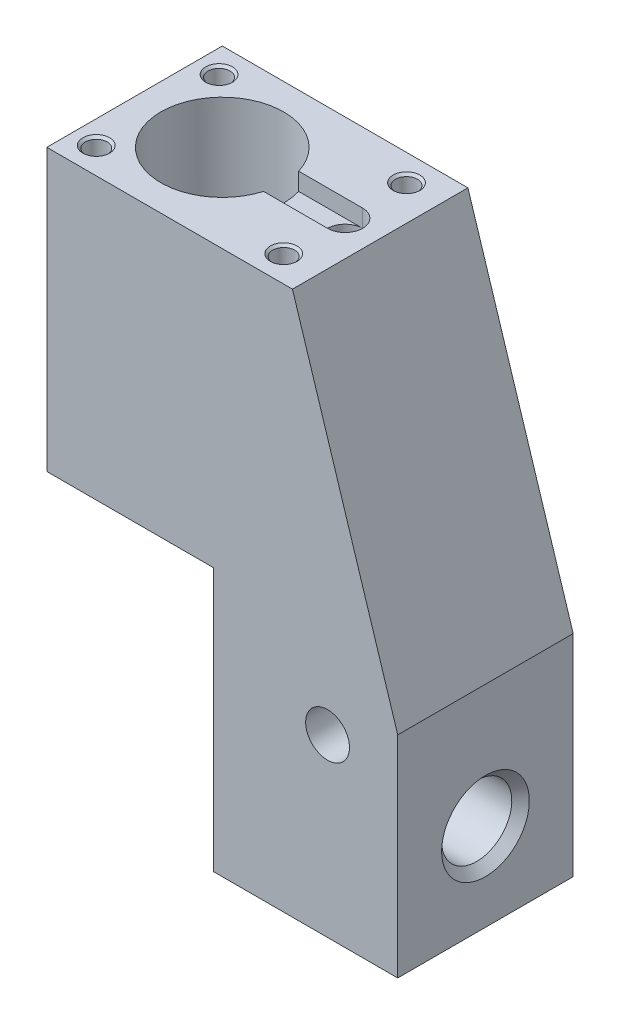
from build123d import *

# Parameters (mm, degrees)
BOSS_EXTRUDE1_DEPTH         = 10
CUT_EXTRUDE1_DEPTH          = 67.21933252457322
CUT_EXTRUDE2_DEPTH          = 2
M3_TAPPED_HOLE1_D           = 2.5
M3_TAPPED_HOLE1_DEPTH       = 9
M3_TAPPED_HOLE1_CSINK_D     = 3.05
M3_TAPPED_HOLE1_CSINK_ANGLE = 90
M3_TAPPED_HOLE1_TIP         = 0.7510757737844503
SKETCH5_R                   = 2.4999999999999987
CUT_EXTRUDE3_DEPTH          = 44.18564576337837
SKETCH6_R                   = 4
CUT_EXTRUDE4_DEPTH          = 53.191953402799555
CHAMFER1_SIZE               = 1
HOLE1_START                 = 2
HOLE1_OUTLINE_R             = 2
HOLE1_DEPTH                 = 28
HOLE1_START_2               = -16.200329062
HOLE1_2_OUTLINE_R           = 1.25
HOLE1_2_DEPTH               = 18.200329062
CUT_EXTRUDE5_REACH          = 54.192
CUT_EXTRUDE5_END_RADIUS     = 7
SKETCH9_R                   = 1.6000000000000005
M4_TAPPED_HOLE1_REACH       = 68.219
M4_TAPPED_HOLE1_BORE_R      = 1.65
CUT_EXTRUDE6_REACH          = 68.219
CUT_EXTRUDE6_END_RADIUS     = 2.4999999999999987
SKETCH12_R                  = 1.2499999999999991


# Read off the part's stored shape, not the designer's step: Hole1
with BuildPart() as part:
    # Sketch1 → Boss-Extrude1 (new, symmetric)
    with BuildSketch(Plane.XY):
        Polygon((0, 0), (-19.000000000000004, -3.04e-15), (-19, 32), (8.999999999999991, 32), (21, -5.9999999999999964), (21, -29.999999999999996), (3.47e-15, -30), align=None)
    extrude(amount=BOSS_EXTRUDE1_DEPTH, both=True)

    # Sketch2 → Cut-Extrude1 (cut, through all)
    with BuildSketch(Plane(origin=(0, 32, 0), x_dir=(1, 0, 0), z_dir=(0, 1, 0))):
        with BuildLine():
            ThreePointArc((-2.2917960675006315, 2.000000000000001), (-10.010587075047079, 6.926666858146693), (-16, -2.25e-15))
            Line((-16, 0), (-2, 0))
            ThreePointArc((-2, 0), (-2.0733331418533067, 1.0105870750470785), (-2.2917960675006315, 2.000000000000001))
        make_face()
        with BuildLine():
            Line((-2, 0), (-16, 0))
            ThreePointArc((-16, 8.6e-16), (-10.01058707504708, -6.926666858146693), (-2.2917960675006324, -2.0000000000000036))
            ThreePointArc((-2.2917960675006324, -2.0000000000000036), (-2.0733331418533067, -1.0105870750470807), (-2, -1.71e-15))
        make_face()
    extrude(amount=-CUT_EXTRUDE1_DEPTH, mode=Mode.SUBTRACT)

    # Sketch2<3> → Cut-Extrude2 (cut)
    with BuildSketch(Plane(origin=(0, 32, 0), x_dir=(1, 0, 0), z_dir=(0, 1, 0))):
        with BuildLine():
            ThreePointArc((5.000000000000001, 2.0000000000000004), (3.585786437626906, 1.4142135623730954), (3.0000000000000004, 2.4e-16))
            Line((3, 0), (7, 0))
            ThreePointArc((7.000000000000002, 0), (6.414213562373096, 1.4142135623730951), (5.000000000000001, 2.0000000000000004))
        make_face()
        with BuildLine():
            Line((7, 0), (3, 0))
            ThreePointArc((3.0000000000000004, 2.4e-16), (3.585786437626905, -1.4142135623730951), (5.000000000000001, -2.0000000000000004))
            ThreePointArc((5.000000000000001, -2.0000000000000004), (6.414213562373096, -1.4142135623730956), (7.000000000000002, -4.9e-16))
        make_face()
        with BuildLine():
            Line((3, 0), (-2, 0))
            ThreePointArc((-2, -1.71e-15), (-2.0733331418533067, -1.0105870750470807), (-2.2917960675006324, -2.0000000000000036))
            Line((-2.2917960675006315, -2.0000000000000013), (5.000000000000001, -2.0000000000000004))
            ThreePointArc((5.000000000000001, -2.0000000000000004), (3.585786437626905, -1.4142135623730951), (3.0000000000000004, 2.4e-16))
        make_face()
        with BuildLine():
            ThreePointArc((-2.2917960675006315, 2.000000000000001), (-2.0733331418533067, 1.0105870750470785), (-2, 0))
            Line((-2, 0), (3, 0))
            ThreePointArc((3.0000000000000004, 2.4e-16), (3.585786437626906, 1.4142135623730954), (5.000000000000001, 2.0000000000000004))
            Line((5.000000000000001, 2.0000000000000004), (-2.2917960675006315, 2.0000000000000013))
        make_face()
    extrude(amount=-CUT_EXTRUDE2_DEPTH, mode=Mode.SUBTRACT)

    # M3 Tapped Hole1
    with Locations(Plane(origin=(0, 32, 0), x_dir=(1, 0, 0), z_dir=(0, 1, 0))):
        with Locations((-16.363887926, 7), (-16.363887926, -7), (5, -7), (5, 7)):
            CounterSinkHole(M3_TAPPED_HOLE1_D / 2, M3_TAPPED_HOLE1_CSINK_D / 2, depth=M3_TAPPED_HOLE1_DEPTH, counter_sink_angle=M3_TAPPED_HOLE1_CSINK_ANGLE)
            with Locations((0, 0, -(M3_TAPPED_HOLE1_DEPTH + M3_TAPPED_HOLE1_TIP / 2))):  # 118° drill point
                Cone(0, M3_TAPPED_HOLE1_D / 2, M3_TAPPED_HOLE1_TIP, mode=Mode.SUBTRACT)

    # Sketch5 → Cut-Extrude3 (cut, through all)
    with BuildSketch(Plane.XY.offset(10)):
        with Locations((13.000000000000002, -9.999999999999998)):
            Circle(SKETCH5_R)
    extrude(amount=-CUT_EXTRUDE3_DEPTH, mode=Mode.SUBTRACT)

    # Sketch6 → Cut-Extrude4 (cut, through all)
    with BuildSketch(Plane(origin=(21, 0, 0), x_dir=(0, 0, -1), z_dir=(1, 0, 0))):
        with Locations((0, -19.999999999999996)):
            Circle(SKETCH6_R)
    extrude(amount=-CUT_EXTRUDE4_DEPTH, mode=Mode.SUBTRACT)

    # Chamfer1
    chamfer1_edges = [part.edges().sort_by_distance(p)[0] for p in [
        (21, -19.999999999999996, 4),
    ]]
    chamfer(chamfer1_edges, length=CHAMFER1_SIZE)

    # Hole1 outline → Hole1 (cut)
    with BuildSketch(Plane(origin=(0, 0, 0), x_dir=(1, 0, 0), z_dir=(0, 1, 0)).offset(HOLE1_START)):
        with Locations((5, 0)):
            Circle(HOLE1_OUTLINE_R)
    extrude(amount=HOLE1_DEPTH, mode=Mode.SUBTRACT)

    # Hole1 2 outline → Hole1 2 (cut)
    with BuildSketch(Plane(origin=(0, 0, 0), x_dir=(1, 0, 0), z_dir=(0, 1, 0)).offset(HOLE1_START_2)):
        with Locations((5, 0)):
            Circle(HOLE1_2_OUTLINE_R)
    extrude(amount=HOLE1_2_DEPTH, mode=Mode.SUBTRACT)

    # Cut-Extrude5: up to this cylinder (the profile starts outside it)
    cut_extrude5_end = Plane(origin=(-9, 15, 0), z_dir=(0, 1, 0)) * Cylinder(CUT_EXTRUDE5_END_RADIUS, 123.384, mode=Mode.PRIVATE)
    # Sketch9 → Cut-Extrude5 (cut, up to the surface)
    with BuildSketch(Plane.ZY.offset(19.000000000000004), mode=Mode.PRIVATE) as cut_extrude5_sk1:
        with Locations(Location((-2.999999999999998, 15, 0), (0, 0, 270))):
            Circle(SKETCH9_R)
    cut_extrude5_tool1 = extrude(cut_extrude5_sk1.sketch, amount=-CUT_EXTRUDE5_REACH, mode=Mode.PRIVATE) - cut_extrude5_end
    add(cut_extrude5_tool1.solids().sort_by_distance((-19, 15, -3))[0], mode=Mode.SUBTRACT)
    # Sketch9 → Cut-Extrude5 (cut, up to the surface)
    with BuildSketch(Plane.ZY.offset(19.000000000000004), mode=Mode.PRIVATE) as cut_extrude5_sk2:
        with Locations(Location((3.000000000000002, 15, 0), (0, 0, 270))):
            Circle(SKETCH9_R)
    cut_extrude5_tool2 = extrude(cut_extrude5_sk2.sketch, amount=-CUT_EXTRUDE5_REACH, mode=Mode.PRIVATE) - cut_extrude5_end
    add(cut_extrude5_tool2.solids().sort_by_distance((-19, 15, 3))[0], mode=Mode.SUBTRACT)

    # M4 Tapped Hole1 bore → M4 Tapped Hole1 (cut, up to next)
    with BuildSketch(Plane(origin=(4.96e-15, -30, 0), x_dir=(-1, -1.7e-16, 0), z_dir=(1.7e-16, -1, 0)), mode=Mode.PRIVATE) as m4_tapped_hole1_sk1:
        with Locations((-13, 0)):
            Circle(M4_TAPPED_HOLE1_BORE_R)
    m4_tapped_hole1_tool1 = extrude(m4_tapped_hole1_sk1.sketch, amount=-M4_TAPPED_HOLE1_REACH, mode=Mode.PRIVATE) & part.part
    # M4 Tapped Hole1 bore → M4 Tapped Hole1 (cut, up to next)
    with BuildSketch(Plane(origin=(4.96e-15, -30, 0), x_dir=(-1, -1.7e-16, 0), z_dir=(1.7e-16, -1, 0)), mode=Mode.PRIVATE) as m4_tapped_hole1_sk2:
        with Locations((-5, 0)):
            Circle(M4_TAPPED_HOLE1_BORE_R)
    m4_tapped_hole1_tool2 = extrude(m4_tapped_hole1_sk2.sketch, amount=-M4_TAPPED_HOLE1_REACH, mode=Mode.PRIVATE) & part.part
    add(m4_tapped_hole1_tool1.solids().sort_by_distance((13, -30, 0))[0], mode=Mode.SUBTRACT)
    add(m4_tapped_hole1_tool2.solids().sort_by_distance((5, -30, 0))[0], mode=Mode.SUBTRACT)

    # Cut-Extrude6: up to this cylinder (the profile starts outside it)
    cut_extrude6_end = Plane(origin=(13.000000000000002, -9.999999999999998, 0), z_dir=(0, 0, 1)) * Cylinder(CUT_EXTRUDE6_END_RADIUS, 142.438, mode=Mode.PRIVATE)
    # Sketch12 → Cut-Extrude6 (cut, up to the surface)
    with BuildSketch(Plane.XZ.offset(30), mode=Mode.PRIVATE) as cut_extrude6_sk1:
        with Locations((12.999999999999998, 0)):
            Circle(SKETCH12_R)
    cut_extrude6_tool1 = extrude(cut_extrude6_sk1.sketch, amount=-CUT_EXTRUDE6_REACH, mode=Mode.PRIVATE) - cut_extrude6_end
    add(cut_extrude6_tool1.solids().sort_by_distance((13, -30, 0))[0], mode=Mode.SUBTRACT)


solid = part.part
